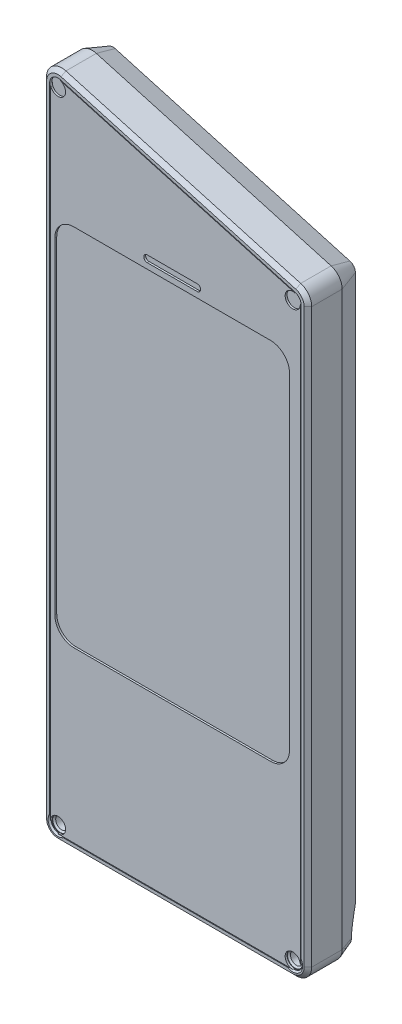
from build123d import *

# Parameters (mm, degrees)
BOSS_EXTRUDE1_START = 0.5
SKETCH1_R           = 1.6
BOSS_EXTRUDE1_DEPTH = 14.5
FILLET1_R           = 4
CHAMFER1_SIZE       = 5.494954839
CHAMFER1_SIZE_2     = 2
CHAMFER2_SIZE       = 1
BOSS_EXTRUDE2_START = -0.5
BOSS_EXTRUDE2_DEPTH = 0.5
CUT_EXTRUDE2_DEPTH  = 0.6


with BuildPart() as part:
    # Sketch1 → Boss-Extrude1 (new body)
    with BuildSketch(Plane.XY.offset(BOSS_EXTRUDE1_START)):
        Polygon((-31.968025007, 151.066521257), (37.831974993, 131.260245954), (37.831974993, -26.340271098), (-31.968025007, -26.340271098), align=None)
        with Locations((-27.968025007, -22.340271098)):
            Circle(SKETCH1_R, mode=Mode.SUBTRACT)
        with Locations((33.831974993, -22.340271098)):
            Circle(SKETCH1_R, mode=Mode.SUBTRACT)
    extrude(amount=-BOSS_EXTRUDE1_DEPTH)

    # Fillet1
    fillet1_edges = [part.edges().sort_by_distance(p)[0] for p in [
        (-31.968025007, 151.066521257, -6.75),
        (37.831974993, 131.260245954, -6.75),
        (37.831974993, -26.340271098, -6.75),
        (-31.968025007, -26.340271098, -6.75),
    ]]
    fillet(fillet1_edges, radius=FILLET1_R)

    # Chamfer1
    # the kernel refuses this chamfer: 5.494954839, 2 mm, written as the material it takes off along each edge
    with BuildSketch(Plane(origin=(-27.968025007, -22.340271098, -14), x_dir=(1, 0, 0), z_dir=(0, -1, 0))) as chamfer1_piece_1:
        Polygon((1.6 + CHAMFER1_SIZE, 0), (1.6, CHAMFER1_SIZE_2), (1.6, 0), align=None)
    revolve(axis=Axis((-27.968025007, -22.340271098, -14), (0, 0, 1)), mode=Mode.SUBTRACT)
    with BuildSketch(Plane(origin=(33.831974993, -22.340271098, -14), x_dir=(1, 0, 0), z_dir=(0, -1, 0))) as chamfer1_piece_2:
        Polygon((1.6 + CHAMFER1_SIZE, 0), (1.6, CHAMFER1_SIZE_2), (1.6, 0), align=None)
    revolve(axis=Axis((33.831974993, -22.340271098, -14), (0, 0, 1)), mode=Mode.SUBTRACT)
    with BuildSketch(Plane(origin=(37.831974993, 128.237356706, -14), x_dir=(-0.9950833631817486, 0, -0.09904090225205021), z_dir=(0, -1, 0))) as chamfer1_piece_3:
        Polygon((CHAMFER1_SIZE_2 * 0.995083363182, -CHAMFER1_SIZE_2 * 0.0990409022521), (-CHAMFER1_SIZE * 0.0990409022504, -CHAMFER1_SIZE * 0.995083363165), (0, 0), align=None)
    extrude(amount=150.577627804, mode=Mode.SUBTRACT)
    with BuildSketch(Plane(origin=(-26.876103777, 149.621650287, -14), x_dir=(0.0035989882615877116, 0.012683322674999943, 0.9999130865277316), z_dir=(0.9620196212654089, -0.2729803075321726, 0))) as chamfer1_piece_4:
        Polygon((CHAMFER1_SIZE * 0.999913086511, CHAMFER1_SIZE * 0.0131840581984), (-CHAMFER1_SIZE_2 * 0.0131840581986, CHAMFER1_SIZE_2 * 0.999913086528), (0, 0), align=None)
    extrude(amount=64.239853984, mode=Mode.SUBTRACT)
    with BuildSketch(Plane(origin=(-31.968025007, -22.340271098, -14), x_dir=(0.9950833631817486, 0, -0.0990409022520504), z_dir=(0, 1, 0))) as chamfer1_piece_5:
        Polygon((CHAMFER1_SIZE_2 * 0.995083363182, -CHAMFER1_SIZE_2 * 0.0990409022521), (-CHAMFER1_SIZE * 0.0990409022504, -CHAMFER1_SIZE * 0.995083363165), (0, 0), align=None)
    extrude(amount=168.1138429, mode=Mode.SUBTRACT)
    with BuildSketch(Plane(origin=(33.831974993, -26.340271098, -14), x_dir=(0, 0.9950833631817486, -0.09904090225205021), z_dir=(-1, 0, 0))) as chamfer1_piece_6:
        Polygon((CHAMFER1_SIZE_2 * 0.995083363182, -CHAMFER1_SIZE_2 * 0.0990409022521), (-CHAMFER1_SIZE * 0.0990409022504, -CHAMFER1_SIZE * 0.995083363165), (0, 0), align=None)
    extrude(amount=61.8, mode=Mode.SUBTRACT)
    with BuildSketch(Plane(origin=(-27.968025007, 145.773571802, -14), x_dir=(0.2729803075321709, 0.9620196212654092, 0), z_dir=(0.9620196212654092, -0.2729803075321709, 0))) as chamfer1_piece_7:
        Polygon((4, CHAMFER1_SIZE), (4 - CHAMFER1_SIZE_2, 0), (4, 0), align=None)
    revolve(axis=Axis((-27.968025007, 145.773571802, -14), (0, 0, 1)), revolution_arc=105.841689768, mode=Mode.SUBTRACT)
    with BuildSketch(Plane(origin=(-27.968025007, -22.340271098, -14), x_dir=(0, -1, 0), z_dir=(1, 0, 0))) as chamfer1_piece_8:
        Polygon((4 - CHAMFER1_SIZE_2, 0), (4, -CHAMFER1_SIZE), (4, 0), align=None)
    revolve(axis=Axis((-27.968025007, -22.340271098, -14), (0, 0, -1)), revolution_arc=90, mode=Mode.SUBTRACT)
    with BuildSketch(Plane(origin=(33.831974993, -22.340271098, -14), x_dir=(1, 0, 0), z_dir=(0, 1, 0))) as chamfer1_piece_9:
        Polygon((4 - CHAMFER1_SIZE_2, 0), (4, -CHAMFER1_SIZE), (4, 0), align=None)
    revolve(axis=Axis((33.831974993, -22.340271098, -14), (0, 0, -1)), revolution_arc=90, mode=Mode.SUBTRACT)
    with BuildSketch(Plane(origin=(33.831974993, 128.237356706, -14), x_dir=(0.27298030753217006, 0.9620196212654094, 0), z_dir=(-0.9620196212654094, 0.27298030753217006, 0))) as chamfer1_piece_10:
        Polygon((4, -CHAMFER1_SIZE), (4 - CHAMFER1_SIZE_2, 0), (4, 0), align=None)
    revolve(axis=Axis((33.831974993, 128.237356706, -14), (0, 0, -1)), revolution_arc=74.158310232, mode=Mode.SUBTRACT)

    # Chamfer2
    chamfer2_edges = [part.edges().sort_by_distance(p)[0] for p in [
        (-29.568025007, -22.340271098, 0.5),
        (32.231974993, -22.340271098, 0.5),
        (37.831974993, 52.948542804, 0.5),
        (-31.968025007, 61.716650352, 0.5),
        (2.931974993, -26.340271098, 0.5),
        (4.023896223, 140.853542739, 0.5),
        (-30.379696116, 148.964785123, 0.5),
        (-30.796452132, -25.168698223, 0.5),
        (36.660402118, -25.168698223, 0.5),
        (37.023188314, 130.649027815, 0.5),
    ]]
    chamfer(chamfer2_edges, length=CHAMFER2_SIZE)

    # Sketch3 → Cut-Extrude2 (cut)
    with BuildSketch(Plane.XY.offset(0.5)):
        with BuildLine():
            Line((-27.968025007, -24.540271098), (33.831974993, -24.540271098))
            ThreePointArc((33.831974993, -24.540271098), (35.387609912, -23.895906017), (36.031974993, -22.340271098))
            Line((36.031974993, -22.340271098), (36.031974993, 128.237356706))
            ThreePointArc((36.031974993, 128.237356706), (35.58714232, 129.563775816), (34.43253167, 130.353799873))
            Line((34.43253167, 130.353799873), (-27.36746833, 147.890014969))
            ThreePointArc((-27.36746833, 147.890014969), (-29.294444117, 147.528739129), (-30.168025007, 145.773571802))
            Line((-30.168025007, 145.773571802), (-30.168025007, -22.340271098))
            ThreePointArc((-30.168025007, -22.340271098), (-29.523659926, -23.895906017), (-27.968025007, -24.540271098))
        make_face()
    extrude(amount=-CUT_EXTRUDE2_DEPTH, mode=Mode.SUBTRACT)


with BuildPart() as body_2:
    # Sketch2 → Boss-Extrude2 (new body)
    with BuildSketch(Plane.XY.offset(0.5).offset(BOSS_EXTRUDE2_START)):
        with BuildLine():
            Line((-27.968025007, -24.340271098), (33.831974993, -24.340271098))
            ThreePointArc((33.831974993, -24.340271098), (32.417761431, -20.926057536), (35.831974993, -22.340271098))
            Line((35.831974993, -22.340271098), (35.831974993, 128.237356706))
            ThreePointArc((35.831974993, 128.237356706), (32.236368332, 127.031521151), (34.377935608, 130.161395948))
            Line((34.377935608, 130.161395948), (-27.422064392, 147.697611045))
            ThreePointArc((-27.422064392, 147.697611045), (-26.762189452, 144.177965142), (-29.968025007, 145.773571802))
            Line((-29.968025007, 145.773571802), (-29.968025007, -22.340271098))
            ThreePointArc((-29.968025007, -22.340271098), (-26.553811445, -20.926057536), (-27.968025007, -24.340271098))
        make_face()
        with BuildLine():
            Line((-23.796575469, 116.120626103), (27.988084902, 116.120626103))
            ThreePointArc((27.988084902, 116.120626103), (31.523618808, 114.656160009), (32.988084902, 111.120626103))
            Line((32.988084902, 111.120626103), (32.988084902, 25.167778842))
            ThreePointArc((32.988084902, 25.167778842), (31.523618808, 21.632244936), (27.988084902, 20.167778842))
            Line((27.988084902, 20.167778842), (-23.796575469, 20.167778842))
            ThreePointArc((-23.796575469, 20.167778842), (-27.332109375, 21.632244936), (-28.796575469, 25.167778842))
            Line((-28.796575469, 25.167778842), (-28.796575469, 111.120626103))
            ThreePointArc((-28.796575469, 111.120626103), (-27.332109375, 114.656160009), (-23.796575469, 116.120626103))
        make_face(mode=Mode.SUBTRACT)
        with BuildLine():
            Line((-4.501435932, 119.382737334), (8.692945365, 119.382737334))
            ThreePointArc((8.692945365, 119.382737334), (9.575424971, 118.500257728), (8.692945365, 117.617778122))
            Line((8.692945365, 117.617778122), (-4.501435932, 117.617778122))
            ThreePointArc((-4.501435932, 117.617778122), (-5.383915538, 118.500257728), (-4.501435932, 119.382737334))
        make_face(mode=Mode.SUBTRACT)
    extrude(amount=BOSS_EXTRUDE2_DEPTH)


solid = Compound([part.part, body_2.part])
